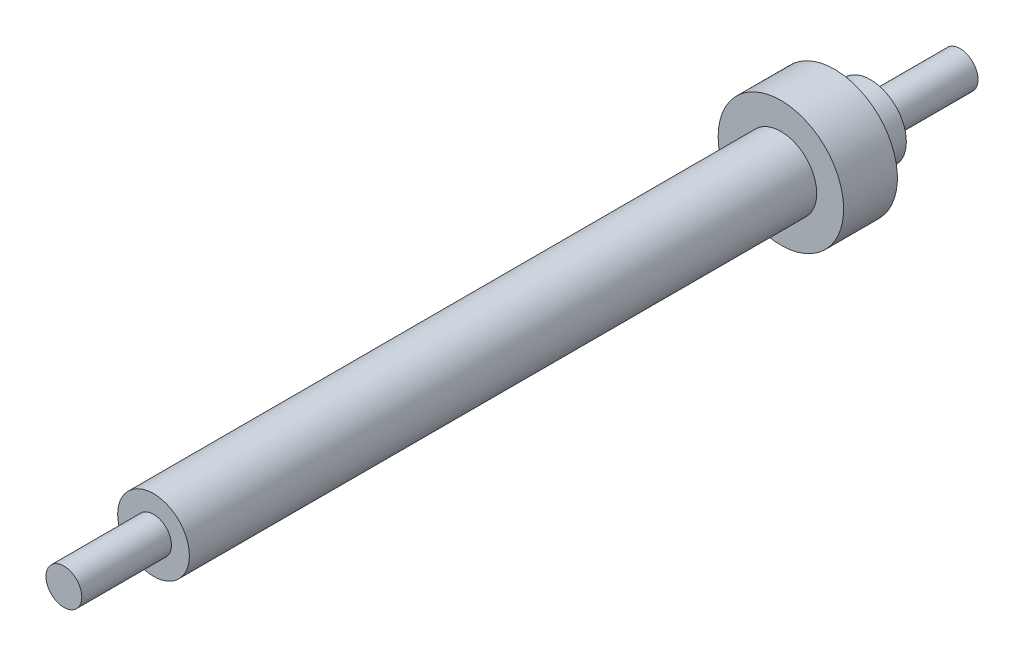
from build123d import *

# Parameters (mm, degrees)
SKETCH_1_R      = 2
EXTRUDE_1_DEPTH = 40
SKETCH_2_R      = 1
EXTRUDE_2_DEPTH = 5
EXTRUDE_START   = 5
SKETCH_4_R      = 1
EXTRUDE_3_DEPTH = 5
EXTRUDE_START_2 = -5
SKETCH_6_R      = 3.5
EXTRUDE_5_DEPTH = 3


with BuildPart() as part:
    # Эскиз1 → Бобышка-Вытянуть1 (new body)
    with BuildSketch(Plane.XY):
        Circle(SKETCH_1_R)
    extrude(amount=EXTRUDE_1_DEPTH)

    # Эскиз2 → Бобышка-Вытянуть2 (add)
    with BuildSketch(Plane.XY.offset(40)):
        Circle(SKETCH_2_R)
    extrude(amount=EXTRUDE_2_DEPTH)

    # Эскиз4 → Бобышка-Вытянуть3 (add)
    with BuildSketch(Plane(origin=(0, 0, 0), x_dir=(-1, 0, 0), z_dir=(0, 0, -1)).offset(EXTRUDE_START)):
        Circle(SKETCH_4_R)
    extrude(amount=-EXTRUDE_3_DEPTH)

    # Эскиз6 → Бобышка-Вытянуть5 (add)
    with BuildSketch(Plane(origin=(0, 0, 0), x_dir=(-1, 0, 0), z_dir=(0, 0, -1)).offset(EXTRUDE_START_2)):
        Circle(SKETCH_6_R)
    extrude(amount=EXTRUDE_5_DEPTH)


solid = part.part
